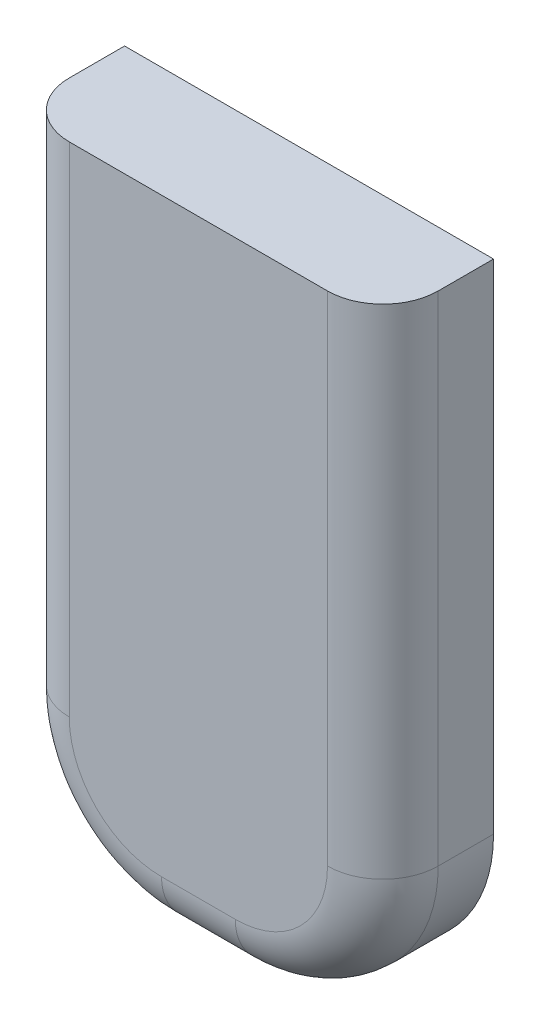
from build123d import *

# Parameters (mm, degrees)
BOSS_EXTRUDE1_DEPTH = 6
FILLET1_R           = 3
SKETCH2_R           = 7.5
CUT_EXTRUDE1_DEPTH  = 4


with BuildPart() as part:
    # Sketch1 → Boss-Extrude1 (new body)
    with BuildSketch(Plane.XY):
        with BuildLine():
            Line((58.585871194, -125), (78.585871194, -125))
            Line((78.585871194, -125), (78.585871194, -152))
            ThreePointArc((78.585871194, -152), (76.242725443, -157.656854249), (70.585871194, -160))
            Line((70.585871194, -160), (66.585871194, -160))
            ThreePointArc((66.585871194, -160), (60.929016944, -157.656854249), (58.585871194, -152))
            Line((58.585871194, -152), (58.585871194, -125))
        make_face()
    extrude(amount=BOSS_EXTRUDE1_DEPTH)

    # Fillet1
    fillet1_edges = [part.edges().sort_by_distance(p)[0] for p in [
        (58.585871194, -138.5, 6),
        (78.585871194, -138.5, 6),
        (76.242725443, -157.656854249, 6),
        (68.585871194, -160, 6),
        (60.929016944, -157.656854249, 6),
    ]]
    fillet(fillet1_edges, radius=FILLET1_R)

    # Sketch2 → Cut-Extrude1 (cut)
    with BuildSketch(Plane(origin=(0, 0, 0), x_dir=(-1, 0, 0), z_dir=(0, 0, -1))):
        with Locations((-68.585871194, -149)):
            Circle(SKETCH2_R)
    extrude(amount=-CUT_EXTRUDE1_DEPTH, mode=Mode.SUBTRACT)


solid = part.part
